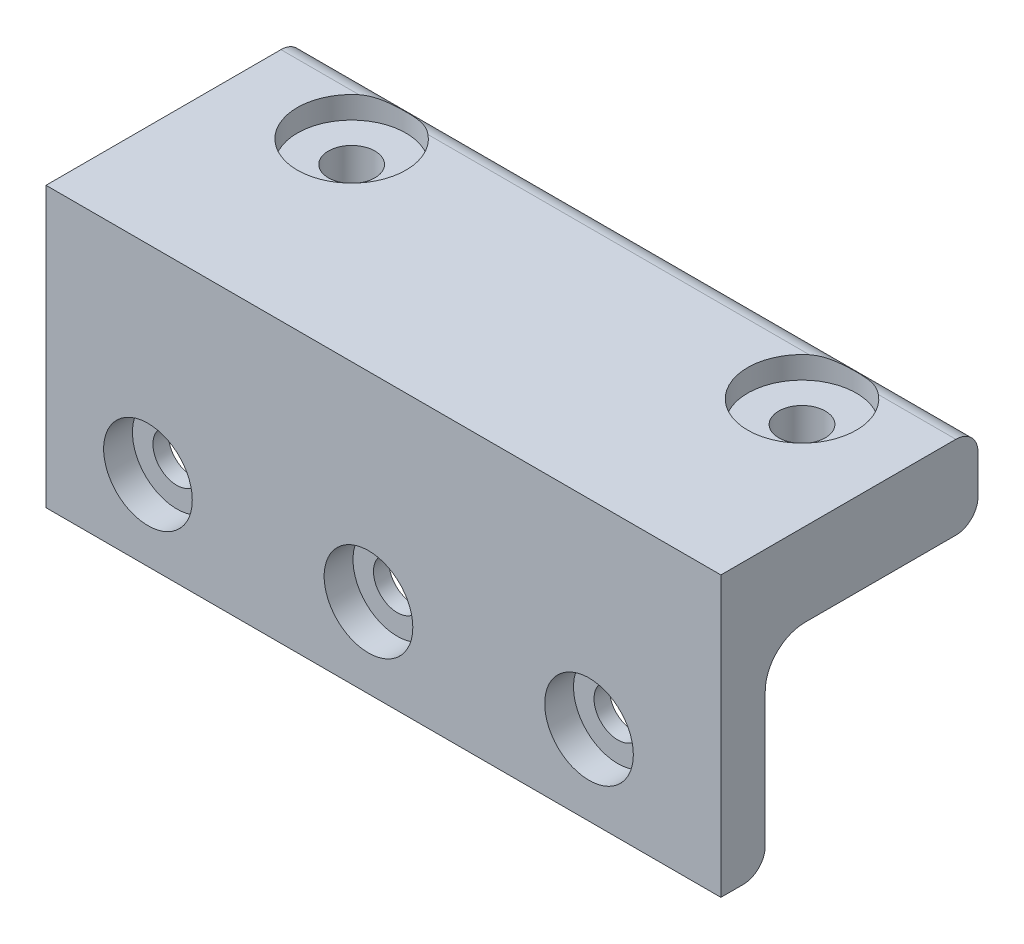
from build123d import *

# Parameters (mm, degrees)
SKETCH1_W             = 60.9
SKETCH1_H             = 25.2
BOSS_EXTRUDE1_DEPTH   = 4
SKETCH3_R             = 4
SKETCH3_R_2           = 2.15
CUT_EXTRUDE1_DEPTH    = 2.6
SKETCH3_2_R           = 2.15
CUT_EXTRUDE2_DEPTH    = 67.029160225
SKETCH4_W             = 19.2
SKETCH4_H             = 7.5
BOSS_EXTRUDE2_DEPTH   = 60.9
SKETCH5_R             = 4.9
CUT_EXTRUDE3_DEPTH    = 2
M5X0_8_TAPPED_HOLE1_D = 4.2
FILLET1_R             = 2
FILLET2_R             = 3.6


with BuildPart() as part:
    # Sketch1 → Boss-Extrude1 (new body)
    with BuildSketch(Plane.XY):
        with Locations((30.45, -12.6)):
            Rectangle(SKETCH1_W, SKETCH1_H)
    extrude(amount=-BOSS_EXTRUDE1_DEPTH)

    # Sketch3 → Cut-Extrude1 (cut)
    # profile 1 of 3: a face of its own
    with BuildSketch(Plane.XY):
        with Locations((9.2, -18)):
            Circle(SKETCH3_R)
        with Locations((9.2, -18)):
            Circle(SKETCH3_R_2, mode=Mode.SUBTRACT)
    # profile 2 of 3: a face of its own
    with BuildSketch(Plane.XY):
        with Locations((29.1, -18)):
            Circle(SKETCH3_R)
        with Locations((29.1, -18)):
            Circle(SKETCH3_R_2, mode=Mode.SUBTRACT)
    # profile 3 of 3: a face of its own
    with BuildSketch(Plane.XY):
        with Locations((49, -18)):
            Circle(SKETCH3_R)
        with Locations((49, -18)):
            Circle(SKETCH3_R_2, mode=Mode.SUBTRACT)
    extrude(amount=-CUT_EXTRUDE1_DEPTH, mode=Mode.SUBTRACT)

    # Sketch3<2> → Cut-Extrude2 (cut, through all)
    with BuildSketch(Plane.XY):
        with Locations((9.2, -18)):
            Circle(SKETCH3_2_R)
        with Locations((29.1, -18)):
            Circle(SKETCH3_2_R)
        with Locations((49, -18)):
            Circle(SKETCH3_2_R)
    extrude(amount=-CUT_EXTRUDE2_DEPTH, mode=Mode.SUBTRACT)

    # Sketch4 → Boss-Extrude2 (add)
    with BuildSketch(Plane.ZY):
        with Locations((-13.6, -3.75)):
            Rectangle(SKETCH4_W, SKETCH4_H)
    extrude(amount=-BOSS_EXTRUDE2_DEPTH)

    # Sketch5 → Cut-Extrude3 (cut)
    with BuildSketch(Plane(origin=(0, 0, 0), x_dir=(1, 0, 0), z_dir=(0, 1, 0))):
        with Locations(Location((10.16, 17.42, 0), (0, 0, 270))):
            Circle(SKETCH5_R)
        with Locations(Location((50.8, 17.42, 0), (0, 0, 270))):
            Circle(SKETCH5_R)
    extrude(amount=-CUT_EXTRUDE3_DEPTH, mode=Mode.SUBTRACT)

    # M5x0.8 Tapped Hole1 (through all)
    with Locations(Plane(origin=(0, -2, 0), x_dir=(1, 0, 0), z_dir=(0, 1, 0))):
        with Locations((10.16, 17.42), (50.8, 17.42)):
            Hole(M5X0_8_TAPPED_HOLE1_D / 2)

    # Fillet1
    # the kernel refuses this fillet: 2 mm, written as the material it takes off along each edge
    with BuildSketch(Plane(origin=(-5, 0, -23.2), x_dir=(0, 0, 1), z_dir=(1, 0, 0)), Plane(origin=(-5, -7.5, -23.2), x_dir=(0, 1, 0), z_dir=(1, 0, 0)), Plane(origin=(65.9, -25.2, -4), x_dir=(0, 0, 1), z_dir=(-1, 0, 0))) as fillet1_piece_1:
        with BuildLine():
            CenterArc((FILLET1_R, FILLET1_R), FILLET1_R, 180, 90)
            Line((0, FILLET1_R), (0, 0))
            Line((0, 0), (FILLET1_R, 0))
        make_face()
    extrude(amount=70.9, mode=Mode.SUBTRACT)

    # Fillet2
    fillet2_edges = [part.edges().sort_by_distance(p)[0] for p in [
        (30.45, -7.5, -4),
    ]]
    fillet(fillet2_edges, radius=FILLET2_R)


solid = part.part
